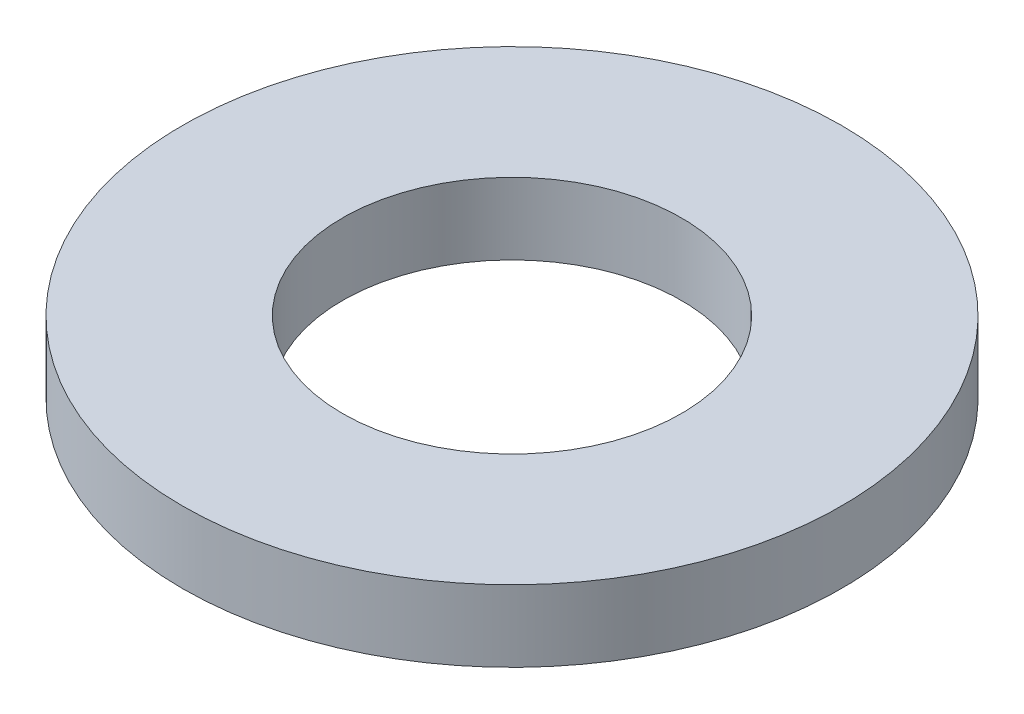
from build123d import *

# Parameters (mm, degrees)
SKETCH1_R           = 87.5
BOSS_EXTRUDE1_DEPTH = 19
SKETCH2_R           = 45
CUT_EXTRUDE1_DEPTH  = 126.193849689


with BuildPart() as part:
    # Sketch1 → Boss-Extrude1 (new body)
    with BuildSketch(Plane(origin=(0, 0, 0), x_dir=(1, 0, 0), z_dir=(0, 1, 0))):
        Circle(SKETCH1_R)
    extrude(amount=BOSS_EXTRUDE1_DEPTH)

    # Sketch2 → Cut-Extrude1 (cut, through all)
    with BuildSketch(Plane(origin=(0, 0, 0), x_dir=(1, 0, 0), z_dir=(0, 1, 0))):
        Circle(SKETCH2_R)
    extrude(amount=CUT_EXTRUDE1_DEPTH, mode=Mode.SUBTRACT)


solid = part.part
